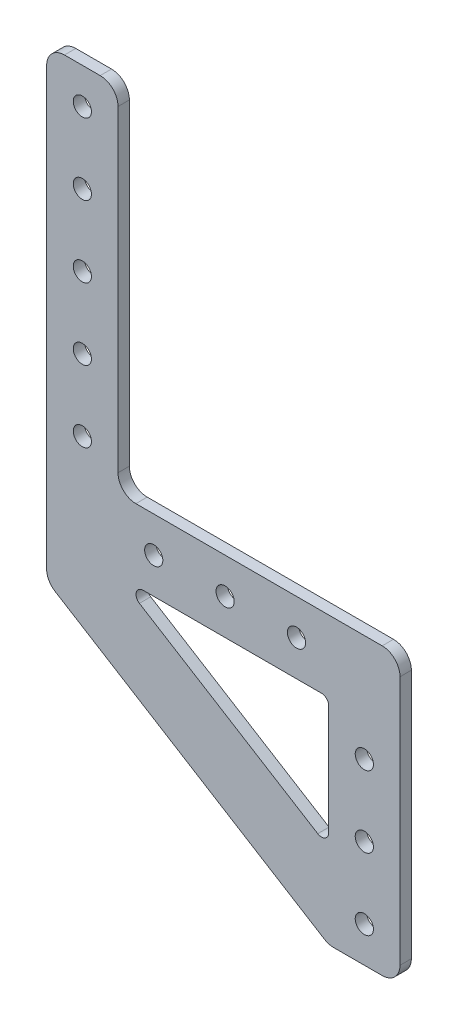
from build123d import *
from OCP.BRepFilletAPI import BRepFilletAPI_MakeFillet

# Parameters (mm, degrees)
SKETCH1_R           = 2.55
BOSS_EXTRUDE1_DEPTH = 1.5875
FILLET1_R1          = 5
FILLET1_R2          = 2


with BuildPart() as part:
    # Sketch1 → Boss-Extrude1 (new, symmetric)
    with BuildSketch(Plane.XY):
        Polygon((-79, 118.852623411), (-59, 118.852623411), (-59, 20), (20, 20), (20, -60), (0, -60), (-79, -11.147376589), align=None)
        with Locations((-69, 108.852623411)):
            Circle(SKETCH1_R, mode=Mode.SUBTRACT)
        with Locations((-69, 88.852623411)):
            Circle(SKETCH1_R, mode=Mode.SUBTRACT)
        with Locations((10, -50)):
            Circle(SKETCH1_R, mode=Mode.SUBTRACT)
        with Locations((10, -30)):
            Circle(SKETCH1_R, mode=Mode.SUBTRACT)
        with Locations((10, -10)):
            Circle(SKETCH1_R, mode=Mode.SUBTRACT)
        with Locations((-49, 10)):
            Circle(SKETCH1_R, mode=Mode.SUBTRACT)
        with Locations((-29, 10)):
            Circle(SKETCH1_R, mode=Mode.SUBTRACT)
        with Locations((-9, 10)):
            Circle(SKETCH1_R, mode=Mode.SUBTRACT)
        with Locations((-69, 68.852623411)):
            Circle(SKETCH1_R, mode=Mode.SUBTRACT)
        with Locations((-69, 48.852623411)):
            Circle(SKETCH1_R, mode=Mode.SUBTRACT)
        with Locations((-69, 28.852623411)):
            Circle(SKETCH1_R, mode=Mode.SUBTRACT)
        Polygon((0, -36.484870649), (0, 0), (-59, 0), align=None, mode=Mode.SUBTRACT)
    extrude(amount=BOSS_EXTRUDE1_DEPTH, both=True)

    # Fillet1: one fillet with a radius per group of edges: ONE call of the kernel's fillet builder (fillet() takes one radius for all edges)
    fillet1_edges_1 = [part.edges().sort_by_distance(p)[0] for p in [
        (-59, 118.852623411, 0),
        (-79, 118.852623411, 0),
        (-59, 20, 0),
        (20, 20, 0),
        (20, -60, 0),
        (0, -60, 0),
        (-79, -11.147376589, 0),
    ]]
    fillet1_edges_2 = [part.edges().sort_by_distance(p)[0] for p in [
        (0, 0, 0),
        (-59, 0, 0),
        (0, -36.484870649, 0),
    ]]
    fillet1 = BRepFilletAPI_MakeFillet(part.part.solid().wrapped)
    for e in fillet1_edges_1:
        fillet1.Add(FILLET1_R1, e.wrapped)
    for e in fillet1_edges_2:
        fillet1.Add(FILLET1_R2, e.wrapped)
    add(Compound.cast(fillet1.Shape()), mode=Mode.REPLACE)


solid = part.part
